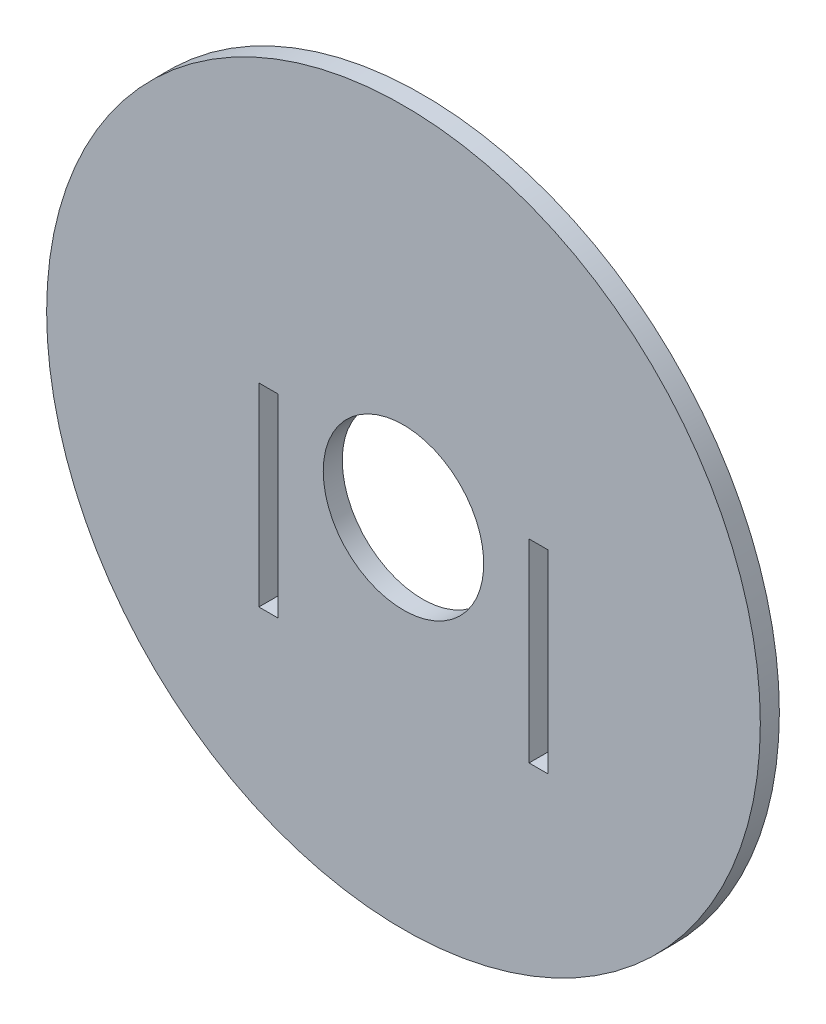
from build123d import *

# Parameters (mm, degrees)
SKETCH1_R           = 28.575
SKETCH1_R_2         = 6.4262
BOSS_EXTRUDE1_DEPTH = 1.524
SKETCH2_W           = 1.524
SKETCH2_H           = 15.536433649
CUT_EXTRUDE1_DEPTH  = 2.54


with BuildPart() as part:
    # Sketch1 → Boss-Extrude1 (new body)
    with BuildSketch(Plane.XY):
        with Locations((59.45306863, -177.922739557)):
            Circle(SKETCH1_R)
        with Locations((59.45306863, -177.922739557)):
            Circle(SKETCH1_R_2, mode=Mode.SUBTRACT)
    extrude(amount=BOSS_EXTRUDE1_DEPTH)

    # Sketch2 → Cut-Extrude1 (cut)
    with BuildSketch(Plane.XY.offset(1.524)):
        with Locations((48.636442896, -182.148527174)):
            Rectangle(SKETCH2_W, SKETCH2_H)
        with Locations((70.269694363, -182.148527174)):
            Rectangle(SKETCH2_W, SKETCH2_H)
    extrude(amount=-CUT_EXTRUDE1_DEPTH, mode=Mode.SUBTRACT)


solid = part.part
